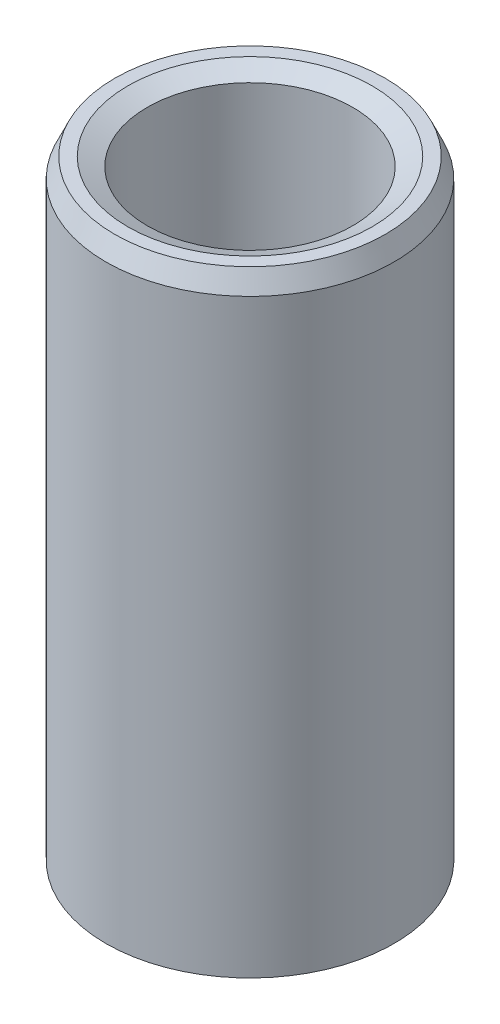
from build123d import *
from OCP.BRepFilletAPI import BRepFilletAPI_MakeChamfer

# Parameters (mm, degrees)
SKETCH1_R           = 15
BOSS_EXTRUDE1_DEPTH = 64.386746666
SKETCH2_R           = 10.690521744
CUT_EXTRUDE1_DEPTH  = 68.791246826
CHAMFER1_SIZE       = 2.024931583
CHAMFER1_SIZE2      = 0.922086532


with BuildPart() as part:
    # Sketch1 → Boss-Extrude1 (new body)
    with BuildSketch(Plane(origin=(0, 0, 0), x_dir=(1, 0, 0), z_dir=(0, 1, 0))):
        Circle(SKETCH1_R)
    extrude(amount=BOSS_EXTRUDE1_DEPTH)

    # Sketch2 → Cut-Extrude1 (cut, through all)
    with BuildSketch(Plane(origin=(0, 0, 0), x_dir=(1, 0, 0), z_dir=(0, 1, 0))):
        Circle(SKETCH2_R)
    extrude(amount=CUT_EXTRUDE1_DEPTH, mode=Mode.SUBTRACT)

    # Chamfer1: one chamfer whose edges measure the first distance from different faces: ONE call of the kernel's chamfer builder (chamfer() names one face for all edges)
    chamfer1_edges_1 = [part.edges().sort_by_distance(p)[0] for p in [
        (-10.690521744, 64.386746666, 0),
    ]]
    chamfer1_side_1 = [part.faces().sort_by_distance(p)[0] for p in [
        (-14.575735931, 64.386746666, 0),
    ]]
    chamfer1_edges_2 = [part.edges().sort_by_distance(p)[0] for p in [
        (-10.690521744, 0, 0),
    ]]
    chamfer1_side_2 = [part.faces().sort_by_distance(p)[0] for p in [
        (-10.690521744, 32.193373333, 0),
    ]]
    chamfer1_edges_3 = [part.edges().sort_by_distance(p)[0] for p in [
        (-15, 0, 0),
    ]]
    chamfer1_side_3 = [part.faces().sort_by_distance(p)[0] for p in [
        (-14.575735931, 0, 0),
    ]]
    chamfer1_edges_4 = [part.edges().sort_by_distance(p)[0] for p in [
        (-15, 64.386746666, 0),
    ]]
    chamfer1_side_4 = [part.faces().sort_by_distance(p)[0] for p in [
        (-15, 32.193373333, 0),
    ]]
    chamfer1 = BRepFilletAPI_MakeChamfer(part.part.solid().wrapped)
    for e in chamfer1_edges_1:
        chamfer1.Add(CHAMFER1_SIZE, CHAMFER1_SIZE2, e.wrapped, chamfer1_side_1[0].wrapped)  # the first distance lies on this face
    for e in chamfer1_edges_2:
        chamfer1.Add(CHAMFER1_SIZE, CHAMFER1_SIZE2, e.wrapped, chamfer1_side_2[0].wrapped)  # the first distance lies on this face
    for e in chamfer1_edges_3:
        chamfer1.Add(CHAMFER1_SIZE, CHAMFER1_SIZE2, e.wrapped, chamfer1_side_3[0].wrapped)  # the first distance lies on this face
    for e in chamfer1_edges_4:
        chamfer1.Add(CHAMFER1_SIZE, CHAMFER1_SIZE2, e.wrapped, chamfer1_side_4[0].wrapped)  # the first distance lies on this face
    add(Compound.cast(chamfer1.Shape()), mode=Mode.REPLACE)


solid = part.part
